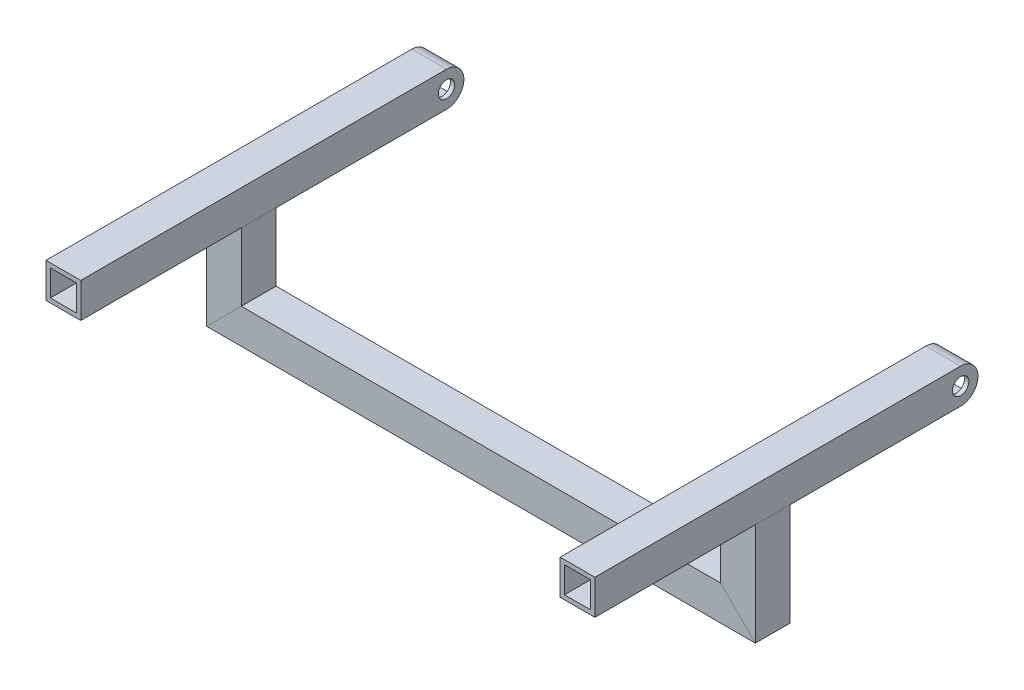
from build123d import *

# Parameters (mm, degrees)
SKETCH1_W                   = 25.4
SKETCH1_H                   = 25.4
SKETCH1_W_2                 = 19.05
SKETCH1_H_2                 = 19.05
KICKSTAND_WELDMENTS_DEPTH   = 280
SKETCH1_ON_SEGMENT_2_W      = 25.4
SKETCH1_ON_SEGMENT_2_H      = 25.4
SKETCH1_ON_SEGMENT_2_W_2    = 19.05
SKETCH1_ON_SEGMENT_2_H_2    = 19.05
KICKSTAND_WELDMENTS_2_DEPTH = 280
SKETCH1_ON_SEGMENT_3_W      = 25.4
SKETCH1_ON_SEGMENT_3_H      = 25.4
SKETCH1_ON_SEGMENT_3_W_2    = 19.05
SKETCH1_ON_SEGMENT_3_H_2    = 19.05
KICKSTAND_WELDMENTS_3_DEPTH = 94.960512242
SKETCH1_ON_SEGMENT_4_W      = 25.4
SKETCH1_ON_SEGMENT_4_H      = 25.4
SKETCH1_ON_SEGMENT_4_W_2    = 19.05
SKETCH1_ON_SEGMENT_4_H_2    = 19.05
KICKSTAND_WELDMENTS_4_DEPTH = 413.671024484
SKETCH1_ON_SEGMENT_5_W      = 25.4
SKETCH1_ON_SEGMENT_5_H      = 25.4
SKETCH1_ON_SEGMENT_5_W_2    = 19.05
SKETCH1_ON_SEGMENT_5_H_2    = 19.05
KICKSTAND_WELDMENTS_5_DEPTH = 94.960512242
FILLET1_R                   = 12.7
FILLET2_R                   = 12.7


with BuildPart() as part:
    # Sketch1 → Kickstand Weldments (new body)
    with BuildSketch(Plane.XY):
        Rectangle(SKETCH1_W, SKETCH1_H)
        Rectangle(SKETCH1_W_2, SKETCH1_H_2, mode=Mode.SUBTRACT)
    extrude(amount=KICKSTAND_WELDMENTS_DEPTH)

    # Sketch4 → Ø12.0 (12) Diameter Hole1 (revolve, cut)
    with BuildSketch(Plane(origin=(-12.7, 0, 12.7), x_dir=(0, 0, 1), z_dir=(0, 1, 0))):
        Polygon((0, 0), (0, 29.005163714), (6, 25.4), (6, 0), align=None)
    f_12_0_12_diameter_hole1 = revolve(axis=Axis((-19.05, 0, 12.7), (1, 0, 0)), mode=Mode.SUBTRACT)

    # Fillet1
    # the kernel refuses this fillet: 12.7 mm, written as the material it takes off along each edge
    with BuildSketch(Plane(origin=(-44.45, 12.7, 0), x_dir=(0, 0, 1), z_dir=(1, 0, 0))) as fillet1_piece_1:
        with BuildLine():
            CenterArc((FILLET1_R, FILLET1_R), FILLET1_R, 180, 90)
            Line((0, FILLET1_R), (0, 0))
            Line((0, 0), (FILLET1_R, 0))
        make_face()
    extrude(amount=88.9, mode=Mode.SUBTRACT)
    with BuildSketch(Plane(origin=(44.45, -12.7, 0), x_dir=(0, 1, 0), z_dir=(-1, 0, 0))) as fillet1_piece_2:
        with BuildLine():
            CenterArc((FILLET1_R, -FILLET1_R), FILLET1_R, 90, 90)
            Line((0, -FILLET1_R), (0, 0))
            Line((0, 0), (FILLET1_R, 0))
        make_face()
    extrude(amount=88.9, mode=Mode.SUBTRACT)


with BuildPart() as body_2:
    # Sketch1 on segment 2 (carried to segment 2) → Kickstand Weldments 2 (new body)
    with BuildSketch(Plane(origin=(375.75, 0, 0), x_dir=(1, 0, 0), z_dir=(0, 0, 1))):
        Rectangle(SKETCH1_ON_SEGMENT_2_W, SKETCH1_ON_SEGMENT_2_H)
        Rectangle(SKETCH1_ON_SEGMENT_2_W_2, SKETCH1_ON_SEGMENT_2_H_2, mode=Mode.SUBTRACT)
    extrude(amount=KICKSTAND_WELDMENTS_2_DEPTH)

    # Mirror2: Ø12.0 (12) Diameter Hole1 across plane
    add(f_12_0_12_diameter_hole1.mirror(Plane(origin=(187.875, 0, 0), x_dir=(0, 0, 1), z_dir=(1, 0, 0))), mode=Mode.SUBTRACT)

    # Fillet2
    # the kernel refuses this fillet: 12.7 mm, written as the material it takes off along each edge
    with BuildSketch(Plane(origin=(420.2, -12.7, 0), x_dir=(0, 1, 0), z_dir=(-1, 0, 0))) as fillet2_piece_1:
        with BuildLine():
            CenterArc((FILLET2_R, -FILLET2_R), FILLET2_R, 90, 90)
            Line((0, -FILLET2_R), (0, 0))
            Line((0, 0), (FILLET2_R, 0))
        make_face()
    extrude(amount=88.9, mode=Mode.SUBTRACT)
    with BuildSketch(Plane(origin=(331.3, 12.7, 0), x_dir=(0, 0, 1), z_dir=(1, 0, 0))) as fillet2_piece_2:
        with BuildLine():
            CenterArc((FILLET2_R, FILLET2_R), FILLET2_R, 180, 90)
            Line((0, FILLET2_R), (0, 0))
            Line((0, 0), (FILLET2_R, 0))
        make_face()
    extrude(amount=88.9, mode=Mode.SUBTRACT)


with BuildPart() as body_3:
    # Sketch1 on segment 3 (carried to segment 3) → Kickstand Weldments 3 (new body)
    with BuildSketch(Plane(origin=(375.75, 1, 150), x_dir=(1, 0, 0), z_dir=(0, -1, 0))):
        Rectangle(SKETCH1_ON_SEGMENT_3_W, SKETCH1_ON_SEGMENT_3_H)
        Rectangle(SKETCH1_ON_SEGMENT_3_W_2, SKETCH1_ON_SEGMENT_3_H_2, mode=Mode.SUBTRACT)
    extrude(amount=KICKSTAND_WELDMENTS_3_DEPTH)

    # Kickstand Weldments 3 mitre 1
    split(bisect_by=Plane(origin=(375.75, -75, 150), x_dir=(-0.707106781, 0.707106781, 0), z_dir=(0.707106781, 0.707106781, 0)), keep=Keep.TOP)

    # Kickstand Weldments 3 mitre 2
    split(bisect_by=Plane(origin=(375.75, -12.7, 150), x_dir=(1, 0, 0), z_dir=(0, -1, 0)), keep=Keep.TOP)


with BuildPart() as body_4:
    # Sketch1 on segment 4 (carried to segment 4) → Kickstand Weldments 4 (new body)
    with BuildSketch(Plane(origin=(394.710512242, -75, 150), x_dir=(0, 0, 1), z_dir=(-1, 0, 0))):
        Rectangle(SKETCH1_ON_SEGMENT_4_W, SKETCH1_ON_SEGMENT_4_H)
        Rectangle(SKETCH1_ON_SEGMENT_4_W_2, SKETCH1_ON_SEGMENT_4_H_2, mode=Mode.SUBTRACT)
    extrude(amount=KICKSTAND_WELDMENTS_4_DEPTH)

    # Kickstand Weldments 4 mitre 1
    split(bisect_by=Plane(origin=(375.75, -75, 150), x_dir=(0.707106781, -0.707106781, 0), z_dir=(-0.707106781, -0.707106781, 0)), keep=Keep.TOP)

    # Kickstand Weldments 4 mitre 2
    split(bisect_by=Plane(origin=(0, -75, 150), x_dir=(0.707106781, 0.707106781, 0), z_dir=(0.707106781, -0.707106781, 0)), keep=Keep.TOP)


with BuildPart() as body_5:
    # Sketch1 on segment 5 (carried to segment 5) → Kickstand Weldments 5 (new body)
    with BuildSketch(Plane(origin=(0, 1, 150), x_dir=(1, 0, 0), z_dir=(0, -1, 0))):
        Rectangle(SKETCH1_ON_SEGMENT_5_W, SKETCH1_ON_SEGMENT_5_H)
        Rectangle(SKETCH1_ON_SEGMENT_5_W_2, SKETCH1_ON_SEGMENT_5_H_2, mode=Mode.SUBTRACT)
    extrude(amount=KICKSTAND_WELDMENTS_5_DEPTH)

    # Kickstand Weldments 5 mitre 1
    split(bisect_by=Plane(origin=(0, -75, 150), x_dir=(-0.707106781, -0.707106781, 0), z_dir=(-0.707106781, 0.707106781, 0)), keep=Keep.TOP)

    # Kickstand Weldments 5 mitre 2
    split(bisect_by=Plane(origin=(0, -12.7, 150), x_dir=(1, 0, 0), z_dir=(0, -1, 0)), keep=Keep.TOP)


solid = Compound([part.part, body_2.part, body_3.part, body_4.part, body_5.part])
